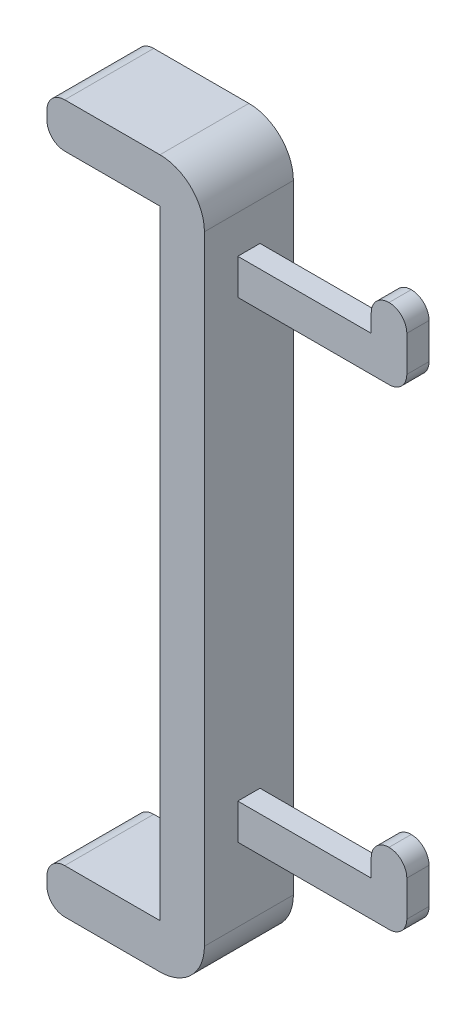
from build123d import *

# Parameters (mm, degrees)
BOSS_EXTRUDE1_DEPTH      = 10
BOSS_EXTRUDE1_DEPTH_BACK = 10
BOSS_EXTRUDE2_DEPTH      = 2.5
BOSS_EXTRUDE2_DEPTH_BACK = 2.5
FILLET1_R                = 10
FILLET2_R                = 4
FILLET3_R                = 4


with BuildPart() as part:
    # Sketch1 → Boss-Extrude1 (new, two sides: drawn at the far end of the back side and taken through both)
    with BuildSketch(Plane.XY.offset(-BOSS_EXTRUDE1_DEPTH_BACK)):
        Polygon((-22.510382525, 3.694889185), (-22.510382525, 30.211555852), (-22.510382525, 56.728222519), (-57.910382525, 56.728222519), (-57.910382525, 46.728222519), (-32.510382525, 46.728222519), (-32.510382525, -92.371777481), (-57.910382525, -92.371777481), (-57.910382525, -102.371777481), (-22.510382525, -102.371777481), (-22.510382525, -75.855110815), (-22.510382525, -49.338444148), (-22.510382525, -22.821777481), align=None)
    extrude(amount=BOSS_EXTRUDE1_DEPTH + BOSS_EXTRUDE1_DEPTH_BACK)

    # Sketch1<3> → Boss-Extrude2 (add, two sides: drawn at the far end of the back side and taken through both)
    with BuildSketch(Plane.XY.offset(-BOSS_EXTRUDE2_DEPTH_BACK)):
        Polygon((7.489617475, 38.211555852), (-22.510382525, 38.211555852), (-22.510382525, 30.211555852), (15.489617475, 30.211555852), (15.489617475, 46.211555852), (7.489617475, 46.211555852), align=None)
        Polygon((7.489617475, -67.855110815), (-22.510382525, -67.855110815), (-22.510382525, -75.855110815), (15.489617475, -75.855110815), (15.489617475, -59.855110815), (7.489617475, -59.855110815), align=None)
    extrude(amount=BOSS_EXTRUDE2_DEPTH + BOSS_EXTRUDE2_DEPTH_BACK)

    # Fillet1
    fillet1_edges = [part.edges().sort_by_distance(p)[0] for p in [
        (-22.510382525, -102.371777481, 0),
        (-22.510382525, 56.728222519, 0),
    ]]
    fillet(fillet1_edges, radius=FILLET1_R)

    # Fillet2
    fillet2_edges = [part.edges().sort_by_distance(p)[0] for p in [
        (-57.910382525, -102.371777481, 0),
        (-57.910382525, -92.371777481, 0),
        (7.489617475, -59.855110815, 0),
        (15.489617475, -59.855110815, 0),
        (15.489617475, -75.855110815, 0),
        (7.489617475, 46.211555852, 0),
        (15.489617475, 46.211555852, 0),
        (15.489617475, 30.211555852, 0),
        (-57.910382525, 56.728222519, 0),
    ]]
    fillet(fillet2_edges, radius=FILLET2_R - 0.0001)  # a hair under: the kernel refuses the full size

    # Fillet3
    fillet3_edges = [part.edges().sort_by_distance(p)[0] for p in [
        (-57.910382525, 46.728222519, 0),
    ]]
    fillet(fillet3_edges, radius=FILLET3_R)


solid = part.part
